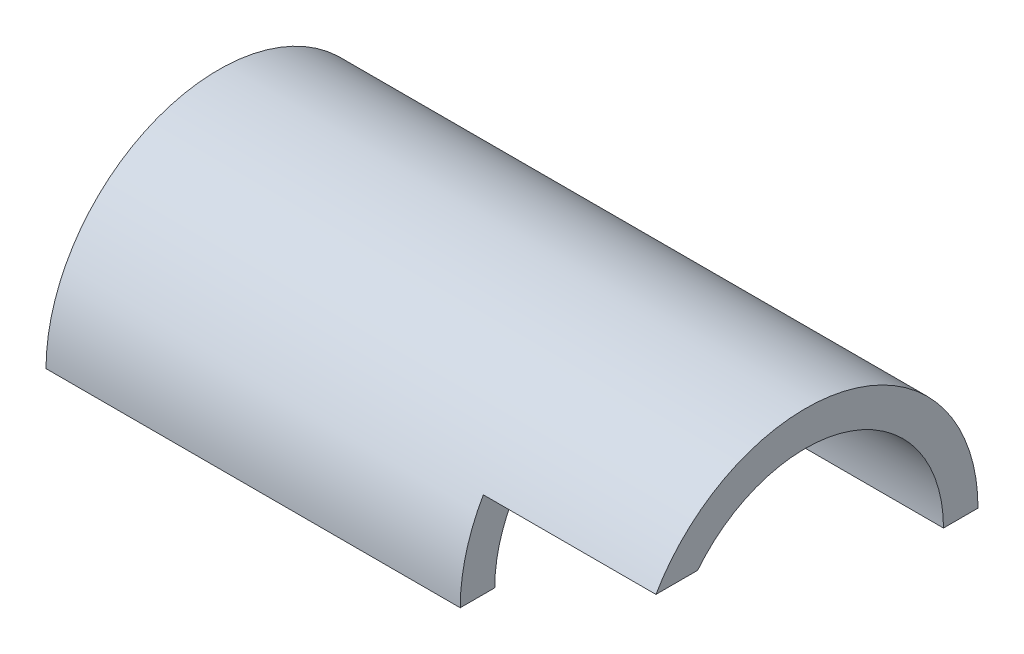
from build123d import *

# Parameters (mm, degrees)
BOSS_EXTRUDE1_DEPTH = 107.95
SKETCH2_W           = 31.75
SKETCH2_H           = 15.875
CUT_EXTRUDE1_DEPTH  = 127


with BuildPart() as part:
    # Sketch1 → Boss-Extrude1 (new body)
    with BuildSketch(Plane(origin=(0, 0, 0), x_dir=(0, 0, -1), z_dir=(1, 0, 0))):
        with BuildLine():
            Line((-31.75, 0), (-25.4, 0))
            ThreePointArc((-25.4, 0), (0, 25.4), (25.4, 0))
            Line((25.4, 0), (31.75, 0))
            ThreePointArc((31.75, 0), (0, 31.75), (-31.75, 0))
        make_face()
    extrude(amount=-BOSS_EXTRUDE1_DEPTH)

    # Sketch2 → Cut-Extrude1 (cut)
    with BuildSketch(Plane.XY):
        with Locations((-15.875, 7.9375)):
            Rectangle(SKETCH2_W, SKETCH2_H)
    extrude(amount=CUT_EXTRUDE1_DEPTH, mode=Mode.SUBTRACT)


solid = part.part
